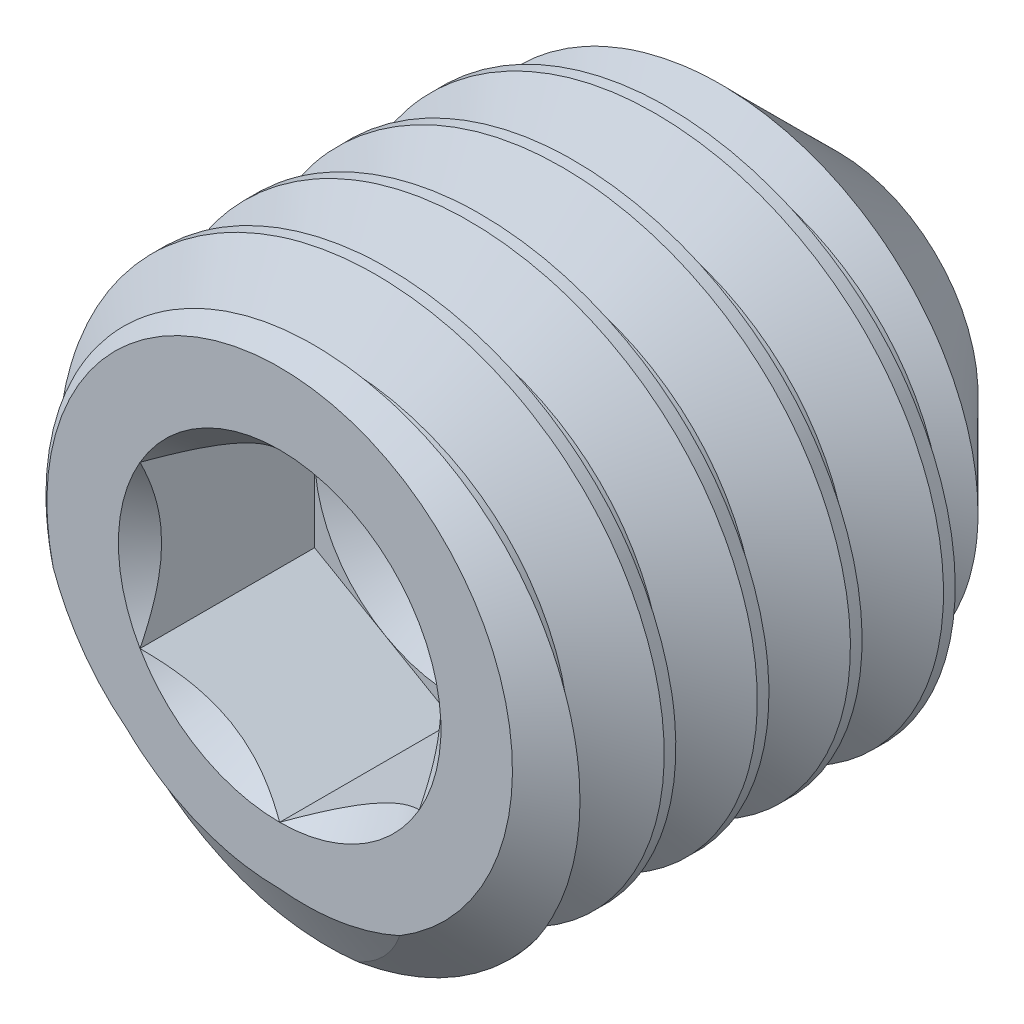
from build123d import *

# Parameters (mm, degrees)
CUT_EXTRUDE1_DEPTH = 0.9375
CUT_SWEEP1_PITCH   = 0.5


with BuildPart() as part:
    # Sketch11 → Revolve1 (revolve)
    with BuildSketch(Plane(origin=(0, 0, 0), x_dir=(0, 0, -1), z_dir=(1, 0, 0)), mode=Mode.PRIVATE) as revolve1_sk:
        Polygon((-1.5, 0), (-1.5, 1.25), (-1.324948115, 1.5), (0.75, 1.5), (1.5, 0.75), (1.049354536, 0), align=None)
    revolve(revolve1_sk.sketch.rotate(Axis((0, 0, -1.049354536), (0, 0, -1)), 180), axis=Axis((0, 0, -1.049354536), (0, 0, -1)))

    # Sketch2 → Cut-Extrude1 (cut)
    with BuildSketch(Plane.XY.offset(1.5)):
        Polygon((0, 0.866025404), (-0.75, 0.433012702), (-0.75, -0.433012702), (0, -0.866025404), (0.75, -0.433012702), (0.75, 0.433012702), align=None)
    extrude(amount=-CUT_EXTRUDE1_DEPTH, mode=Mode.SUBTRACT)

    # Cut-Extrude2 cone 1 section (through the dimple's axis) → Cut-Extrude2 (revolve, cut)
    with BuildSketch(Plane(origin=(0, 0, 1.5), x_dir=(0, -1, 0), z_dir=(1, 0, 0))):
        Polygon((0, 0), (0.866025404, 0), (0, 0.866025404), align=None)
    revolve(axis=Axis((0, 0, 1.5), (0, 0, -1)), mode=Mode.SUBTRACT)

    # Cut-Extrude3 cone 1 section (through the dimple's axis) → Cut-Extrude3 (revolve, cut)
    with BuildSketch(Plane(origin=(0, 0, 0.5625), x_dir=(0, -1, 0), z_dir=(1, 0, 0))):
        Polygon((0, 0), (0.75, 0), (0, 0.433012702), align=None)
    revolve(axis=Axis((0, 0, 0.5625), (0, 0, -1)), mode=Mode.SUBTRACT)

    # Cut-Sweep1: the profile of Sketch6 screwed along a right-hand helix of 6.6 turns, 6 arcs to a turn; built about Z, then put on its axis
    cut_sweep1_z = Axis((0, 0, 0), (0, 0, 1))
    cut_sweep1_corners = [(1.175240474, 0, -0.1875), (1.527063294, 0, 0.015625), (1.527063294, 0, -0.453125), (1.175240474, 0, -0.25)]
    with BuildLine(mode=Mode.PRIVATE) as cut_sweep1_profile:
        Line(cut_sweep1_corners[0], cut_sweep1_corners[1])
        Line(cut_sweep1_corners[1], cut_sweep1_corners[2])
        Line(cut_sweep1_corners[2], cut_sweep1_corners[3])
        Line(cut_sweep1_corners[3], cut_sweep1_corners[0])
    cut_sweep1_cap = Face(cut_sweep1_profile.wire())
    cut_sweep1_turn_angles = [0, 30, 60, 90, 120, 150, 180, 210, 240, 270, 300, 330, 360]
    cut_sweep1_turn_weights = [1, 0.8660254037844387, 1, 0.8660254037844387, 1, 0.8660254037844387, 1, 0.8660254037844387, 1, 0.8660254037844387, 1, 0.8660254037844387, 1]
    cut_sweep1_turn_rails = [Edge.make_bspline([Vector(p[0], p[1], 0).rotate(cut_sweep1_z, cut_sweep1_turn_angles[k]) / cut_sweep1_turn_weights[k] + Vector(0, 0, p[2] + CUT_SWEEP1_PITCH * cut_sweep1_turn_angles[k] / 360) for k in range(13)], [0, 0, 0, 1, 1, 2, 2, 3, 3, 4, 4, 5, 5, 6, 6, 6], 2, cut_sweep1_turn_weights) for p in cut_sweep1_corners]
    cut_sweep1_turn_sides = [Face.make_surface_from_curves(cut_sweep1_turn_rails[p[0]], cut_sweep1_turn_rails[p[1]]) for p in [(0, 1), (1, 2), (2, 3), (3, 0)]]
    cut_sweep1_last_angles = [2160, 2190, 2220, 2250, 2280, 2310, 2340, 2358, 2376]
    cut_sweep1_last_weights = [1, 0.8660254037844387, 1, 0.8660254037844387, 1, 0.8660254037844387, 1, 0.9510565162951377, 1]
    cut_sweep1_last_rails = [Edge.make_bspline([Vector(p[0], p[1], 0).rotate(cut_sweep1_z, cut_sweep1_last_angles[k]) / cut_sweep1_last_weights[k] + Vector(0, 0, p[2] + CUT_SWEEP1_PITCH * cut_sweep1_last_angles[k] / 360) for k in range(9)], [0, 0, 0, 1, 1, 2, 2, 3, 3, 4, 4, 4], 2, cut_sweep1_last_weights) for p in cut_sweep1_corners]
    cut_sweep1_last_sides = [Face.make_surface_from_curves(cut_sweep1_last_rails[p[0]], cut_sweep1_last_rails[p[1]]) for p in [(0, 1), (1, 2), (2, 3), (3, 0)]]
    cut_sweep1 = Plane(origin=(0, 0, -1.5), x_dir=(0, 1, 0), z_dir=(0, 0, 1)) * Solid(Shell([*[p.moved(Location((0, 0, CUT_SWEEP1_PITCH * i))) for i in range(6) for p in cut_sweep1_turn_sides], *cut_sweep1_last_sides, cut_sweep1_cap, cut_sweep1_cap.rotate(cut_sweep1_z, 2376).moved(Location((0, 0, CUT_SWEEP1_PITCH * 2376 / 360)))]))
    add(cut_sweep1, mode=Mode.SUBTRACT)


solid = part.part
